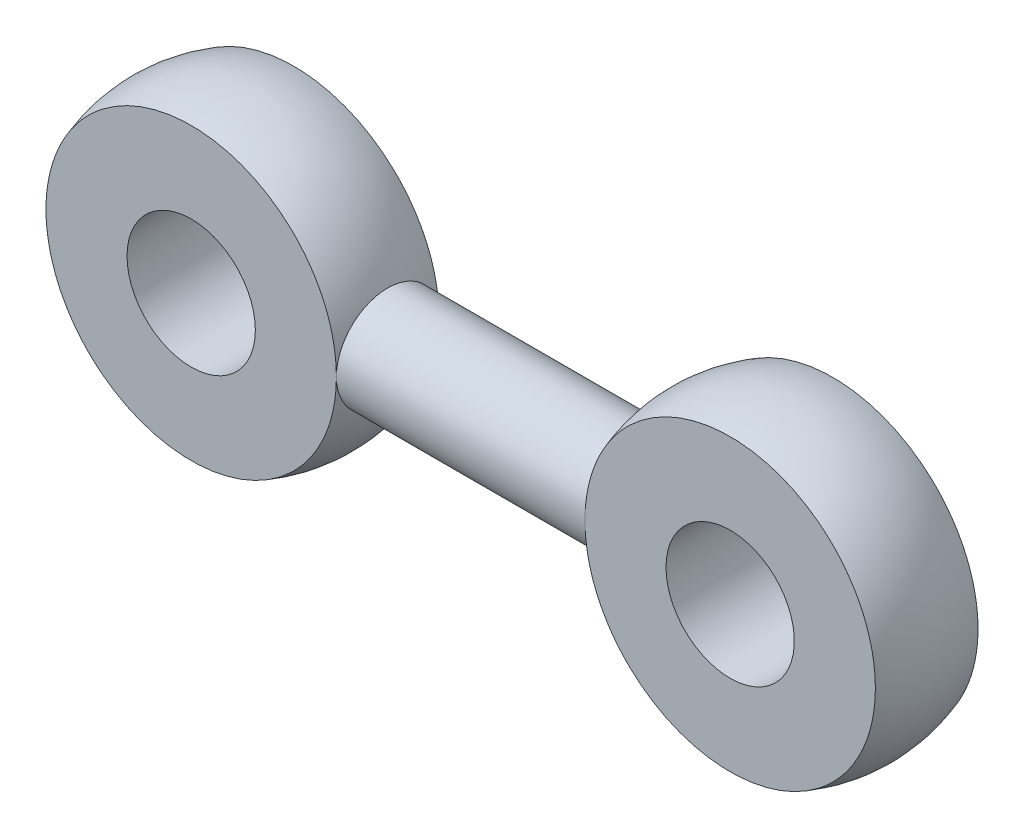
from build123d import *
from build123d.topology import SkipClean

# Parameters (mm, degrees)
CUT_EXTRUDE4_DEPTH       = 29.301943396
CUT_EXTRUDE4_DEPTH_BACK  = 29.301943396
CUT_EXTRUDE5_REACH       = 30.792
SKETCH5_R                = 2.5
CUT_EXTRUDE10_DEPTH      = 10
CUT_EXTRUDE10_DEPTH_BACK = 10
SKETCH9_R                = 2.5
CUT_EXTRUDE11_DEPTH      = 10


with BuildPart() as part:
    # Sketch1 → Revolve1 (revolve)
    with BuildSketch(Plane.XY):
        with BuildLine():
            Line((6, 0), (-27, 0))
            ThreePointArc((-27, 0), (-22.014611872, 5.913591358), (-15.343145751, 2))
            Line((-15.343145751, 2), (-5.656854249, 2))
            ThreePointArc((-5.656854249, 2), (1.014611872, 5.913591358), (6, 0))
        make_face()
    revolve(axis=Axis((6.214656997, 0, 0), (-1, 0, 0)))

    # Sketch4 → Cut-Extrude4 (cut, two sides: drawn at the far end of the back side and taken through both)
    with SkipClean():  # the faces are left unmerged after this step: merging them gives an invalid solid
        with BuildSketch(Plane(origin=(0, 0, 0), x_dir=(1, 0, 0), z_dir=(0, 1, 0)).offset(-CUT_EXTRUDE4_DEPTH_BACK)):
            with BuildLine():
                Line((-5.656854249, 2), (5.656854249, 2))
                ThreePointArc((5.656854249, 2), (0, 6), (-5.656854249, 2))
            make_face()
            with BuildLine():
                Line((-5.656854249, -2), (5.656854249, -2))
                ThreePointArc((5.656854249, -2), (0, -6), (-5.656854249, -2))
            make_face()
        extrude(amount=CUT_EXTRUDE4_DEPTH + CUT_EXTRUDE4_DEPTH_BACK, mode=Mode.SUBTRACT)

    # Sketch5 → Cut-Extrude5 (cut, up to next)
    with BuildSketch(Plane(origin=(0, 0, -2), x_dir=(-1, 0, 0), z_dir=(0, 0, -1)), mode=Mode.PRIVATE) as cut_extrude5_sk1:
        Circle(SKETCH5_R)
    cut_extrude5_tool1 = extrude(cut_extrude5_sk1.sketch, amount=-CUT_EXTRUDE5_REACH, mode=Mode.PRIVATE) & part.part
    add(cut_extrude5_tool1.solids().sort_by_distance((0, 0, -2))[0], mode=Mode.SUBTRACT)

    # Sketch8 → Cut-Extrude10 (cut, two sides: drawn at the far end of the back side and taken through both)
    with SkipClean():  # the faces are left unmerged after this step: merging them gives an invalid solid
        with BuildSketch(Plane(origin=(0, 0, 0), x_dir=(1, 0, 0), z_dir=(0, 1, 0)).offset(-CUT_EXTRUDE10_DEPTH_BACK)):
            with BuildLine():
                Line((-15.343145751, 2), (-26.656854249, 2))
                ThreePointArc((-26.656854249, 2), (-21, 6), (-15.343145751, 2))
            make_face()
            with BuildLine():
                Line((-15.343145751, -2), (-26.656854249, -2))
                ThreePointArc((-26.656854249, -2), (-21, -6), (-15.343145751, -2))
            make_face()
        extrude(amount=CUT_EXTRUDE10_DEPTH + CUT_EXTRUDE10_DEPTH_BACK, mode=Mode.SUBTRACT)

    # Sketch9 → Cut-Extrude11 (cut)
    with SkipClean():  # the faces are left unmerged after this step: merging them gives an invalid solid
        with BuildSketch(Plane(origin=(0, 0, -2), x_dir=(-1, 0, 0), z_dir=(0, 0, -1))):
            with Locations((21, 0)):
                Circle(SKETCH9_R)
        extrude(amount=-CUT_EXTRUDE11_DEPTH, mode=Mode.SUBTRACT)


solid = part.part
